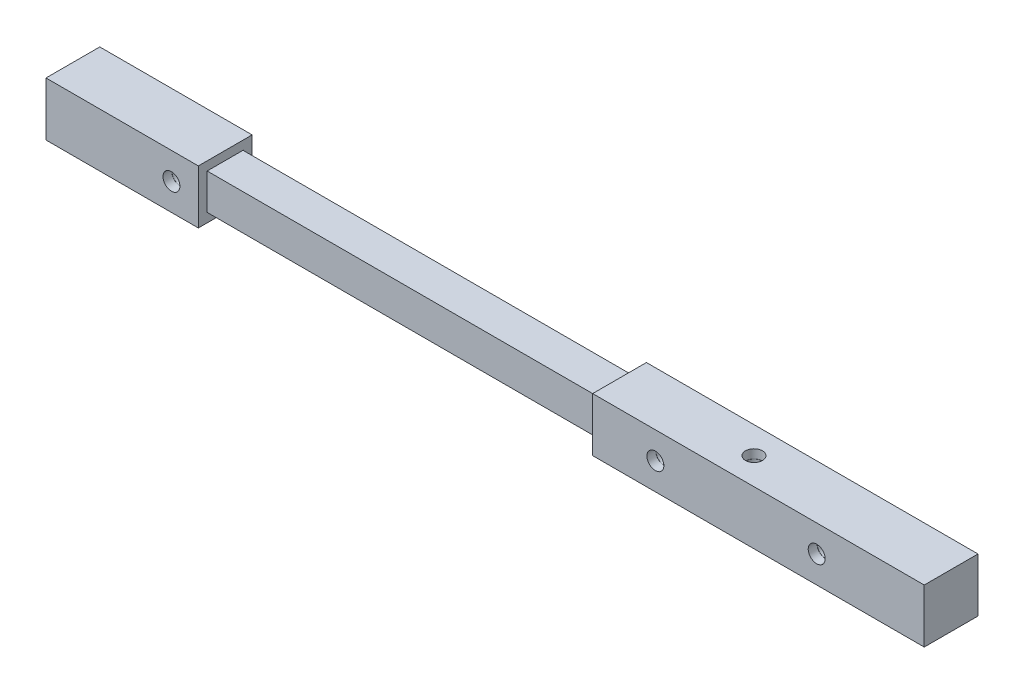
from build123d import *

# Parameters (mm, degrees)
SKETCH1_W               = 6.35
SKETCH1_H               = 6.35
BOSS_EXTRUDE1_DEPTH     = 152.4
SKETCH2_R               = 1.5
CUT_EXTRUDE1_DEPTH      = 153.565274965
SKETCH3_R               = 1.5
CUT_EXTRUDE2_DEPTH      = 153.565274965
SKETCH4_W               = 9.525
SKETCH4_H               = 9.525
SKETCH4_W_2             = 6.4008
SKETCH4_H_2             = 6.4008
BOSS_EXTRUDE2_DEPTH     = 57.15
SKETCH5_W               = 9.525
SKETCH5_H               = 9.525
BOSS_EXTRUDE3_DEPTH     = 1.5875
CUT_EXTRUDE4_DEPTH      = 155.26547076
CUT_EXTRUDE4_DEPTH_BACK = 155.26547076
SKETCH6_R               = 1.5
CUT_EXTRUDE6_DEPTH      = 155.26547076
CUT_EXTRUDE6_DEPTH_BACK = 155.26547076
SKETCH7_R               = 1.5
SKETCH8_W               = 9.525
SKETCH8_H               = 9.525
SKETCH8_W_2             = 6.4008
SKETCH8_H_2             = 6.4008
BOSS_EXTRUDE4_DEPTH     = 25.4
SKETCH9_W               = 9.525
SKETCH9_H               = 9.525
BOSS_EXTRUDE5_DEPTH     = 1.5875
CUT_EXTRUDE8_DEPTH      = 155.26547076
CUT_EXTRUDE8_DEPTH_BACK = 155.26547076
SKETCH10_R              = 1.5


with BuildPart() as part:
    # Sketch1 → Boss-Extrude1 (new body)
    with BuildSketch(Plane(origin=(0, 0, 0), x_dir=(0, 0, -1), z_dir=(1, 0, 0))):
        Rectangle(SKETCH1_W, SKETCH1_H)
    extrude(amount=BOSS_EXTRUDE1_DEPTH)

    # Sketch2 → Cut-Extrude1 (cut, through all)
    with BuildSketch(Plane.XY.offset(3.175)):
        with Locations((20.6375, 0)):
            Circle(SKETCH2_R)
        with Locations((134.9375, 0)):
            Circle(SKETCH2_R)
        with Locations((106.3625, 0)):
            Circle(SKETCH2_R)
    extrude(amount=-CUT_EXTRUDE1_DEPTH, mode=Mode.SUBTRACT)

    # Sketch3 → Cut-Extrude2 (cut, through all)
    with BuildSketch(Plane(origin=(0, 3.175, 0), x_dir=(1, 0, 0), z_dir=(0, 1, 0))):
        with Locations((119.0625, 0)):
            Circle(SKETCH3_R)
    extrude(amount=-CUT_EXTRUDE2_DEPTH, mode=Mode.SUBTRACT)


with BuildPart() as body_2:
    # Sketch4 → Boss-Extrude2 (new body)
    with BuildSketch(Plane(origin=(152.4, 0, 0), x_dir=(0, 0, -1), z_dir=(1, 0, 0))):
        Rectangle(SKETCH4_W, SKETCH4_H)
        Rectangle(SKETCH4_W_2, SKETCH4_H_2, mode=Mode.SUBTRACT)
    extrude(amount=-BOSS_EXTRUDE2_DEPTH)

    # Sketch5 → Boss-Extrude3 (add)
    with BuildSketch(Plane(origin=(152.4, 0, 0), x_dir=(0, 0, -1), z_dir=(1, 0, 0))):
        Rectangle(SKETCH5_W, SKETCH5_H)
    extrude(amount=BOSS_EXTRUDE3_DEPTH)

    # Sketch6 → Cut-Extrude4 (cut, two sides: drawn at the far end of the back side and taken through both)
    with BuildSketch(Plane.XY.offset(3.175).offset(-CUT_EXTRUDE4_DEPTH_BACK)):
        with Locations((134.9375, 0)):
            Circle(SKETCH6_R)
        with Locations((106.3625, 0)):
            Circle(SKETCH6_R)
    extrude(amount=CUT_EXTRUDE4_DEPTH + CUT_EXTRUDE4_DEPTH_BACK, mode=Mode.SUBTRACT)

    # Sketch7 → Cut-Extrude6 (cut, two sides: drawn at the far end of the back side and taken through both)
    with BuildSketch(Plane(origin=(0, 3.175, 0), x_dir=(1, 0, 0), z_dir=(0, 1, 0)).offset(-CUT_EXTRUDE6_DEPTH_BACK)):
        with Locations((119.0625, 0)):
            Circle(SKETCH7_R)
    extrude(amount=CUT_EXTRUDE6_DEPTH + CUT_EXTRUDE6_DEPTH_BACK, mode=Mode.SUBTRACT)


with BuildPart() as body_3:
    # Sketch8 → Boss-Extrude4 (new body)
    with BuildSketch(Plane.ZY):
        Rectangle(SKETCH8_W, SKETCH8_H)
        Rectangle(SKETCH8_W_2, SKETCH8_H_2, mode=Mode.SUBTRACT)
    extrude(amount=-BOSS_EXTRUDE4_DEPTH)

    # Sketch9 → Boss-Extrude5 (add)
    with BuildSketch(Plane.ZY):
        Rectangle(SKETCH9_W, SKETCH9_H)
    extrude(amount=BOSS_EXTRUDE5_DEPTH)

    # Sketch10 → Cut-Extrude8 (cut, two sides: drawn at the far end of the back side and taken through both)
    with BuildSketch(Plane.XY.offset(3.175).offset(-CUT_EXTRUDE8_DEPTH_BACK)):
        with Locations((20.6375, 0)):
            Circle(SKETCH10_R)
    extrude(amount=CUT_EXTRUDE8_DEPTH + CUT_EXTRUDE8_DEPTH_BACK, mode=Mode.SUBTRACT)


solid = Compound([part.part, body_2.part, body_3.part])
